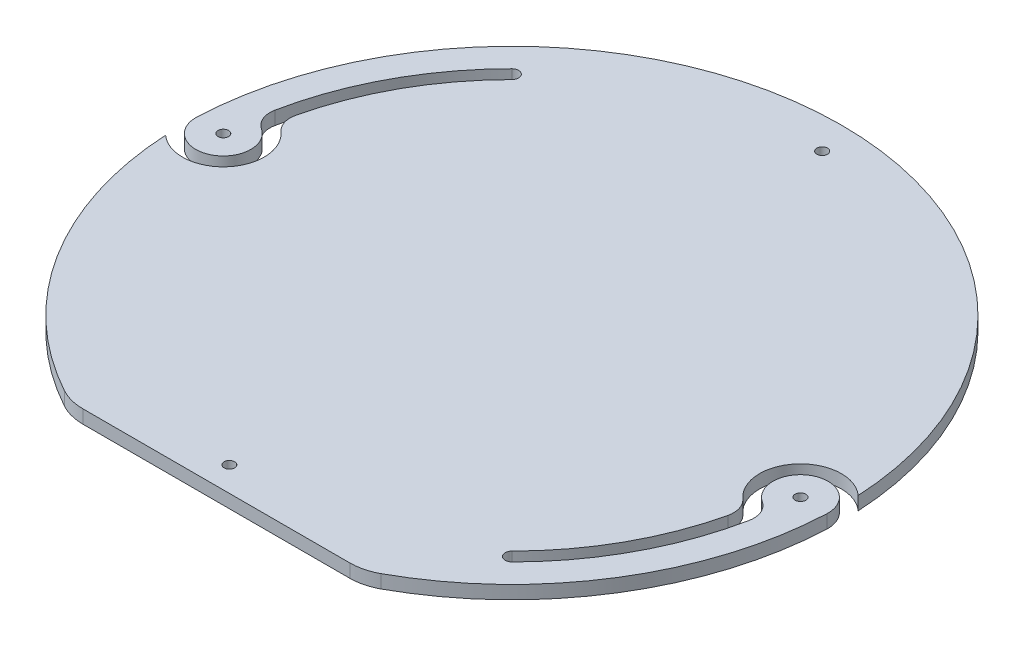
from build123d import *

# Parameters (mm, degrees)
BOSS_EXTRUDE1_DEPTH = 3
SKETCH2_R           = 1.2
CUT_EXTRUDE1_DEPTH  = 105.977521403
CUT_EXTRUDE2_DEPTH  = 105.977521403


with BuildPart() as part:
    # Sketch1 → Boss-Extrude1 (new body)
    with BuildSketch(Plane(origin=(0, 0, 0), x_dir=(1, 0, 0), z_dir=(0, 1, 0))):
        with BuildLine():
            Line((-30.029977361, -66.512867647), (30.029977361, -66.512867647))
            ThreePointArc((30.029977361, -66.512867647), (32.931413623, -66.147401939), (35.651589123, -65.073836471))
            ThreePointArc((35.651589123, -65.073836471), (0, 74.2), (-35.651589123, -65.073836471))
            ThreePointArc((-35.651589123, -65.073836471), (-32.931413623, -66.147401939), (-30.029977361, -66.512867647))
        make_face()
    extrude(amount=BOSS_EXTRUDE1_DEPTH)

    # Sketch2 → Cut-Extrude1 (cut, through all)
    with BuildSketch(Plane(origin=(0, 3, 0), x_dir=(1, 0, 0), z_dir=(0, 1, 0))):
        with Locations((-2.660782629, -60.941941516)):
            Circle(SKETCH2_R)
        with Locations((-67.935279068, 2.966118341)):
            Circle(SKETCH2_R)
        with Locations((2.922498953, 66.936230846)):
            Circle(SKETCH2_R)
        with Locations((67.935279068, -2.966118341)):
            Circle(SKETCH2_R)
    extrude(amount=-CUT_EXTRUDE1_DEPTH, mode=Mode.SUBTRACT)

    # Sketch3 → Cut-Extrude2 (cut, through all)
    with BuildSketch(Plane(origin=(0, 3, 0), x_dir=(1, 0, 0), z_dir=(0, 1, 0))):
        with BuildLine():
            ThreePointArc((-74.129378041, 3.236558543), (-65.111947644, -2.5537367), (-64.529371908, 8.146832232))
            ThreePointArc((-64.529371908, 8.146832232), (-66.395420161, 10.395433666), (-66.686059299, 13.302988203))
            ThreePointArc((-66.686059299, 13.302988203), (-59.961788445, 32.071543875), (-48.083261121, 48.083261121))
            ThreePointArc((-48.083261121, 48.083261121), (-45.961940777, 48.083261121), (-45.961940777, 45.961940777))
            ThreePointArc((-45.961940777, 45.961940777), (-56.839700689, 31.531705085), (-63.324224445, 14.664330822))
            ThreePointArc((-63.324224445, 14.664330822), (-63.220830412, 12.029973663), (-61.791915049, 9.814408532))
            ThreePointArc((-61.791915049, 9.814408532), (-61.096295148, -3.187604024), (-74.099345682, -3.86354364))
            ThreePointArc((-74.099345682, -3.86354364), (-74.19933623, -0.313851977), (-74.129378041, 3.236558543))
        make_face()
        with BuildLine():
            ThreePointArc((74.129378041, -3.236558543), (65.111947644, 2.5537367), (64.529371908, -8.146832232))
            ThreePointArc((64.529371908, -8.146832232), (66.395420161, -10.395433666), (66.686059299, -13.302988203))
            ThreePointArc((66.686059299, -13.302988203), (59.961788445, -32.071543875), (48.083261121, -48.083261121))
            ThreePointArc((48.083261121, -48.083261121), (45.961940777, -48.083261121), (45.961940777, -45.961940777))
            ThreePointArc((45.961940777, -45.961940777), (56.839700689, -31.531705085), (63.324224445, -14.664330822))
            ThreePointArc((63.324224445, -14.664330822), (63.220830412, -12.029973663), (61.791915049, -9.814408532))
            ThreePointArc((61.791915049, -9.814408532), (61.096295148, 3.187604024), (74.099345682, 3.86354364))
            ThreePointArc((74.099345682, 3.86354364), (74.19933623, 0.313851977), (74.129378041, -3.236558543))
        make_face()
    extrude(amount=-CUT_EXTRUDE2_DEPTH, mode=Mode.SUBTRACT)


solid = part.part
